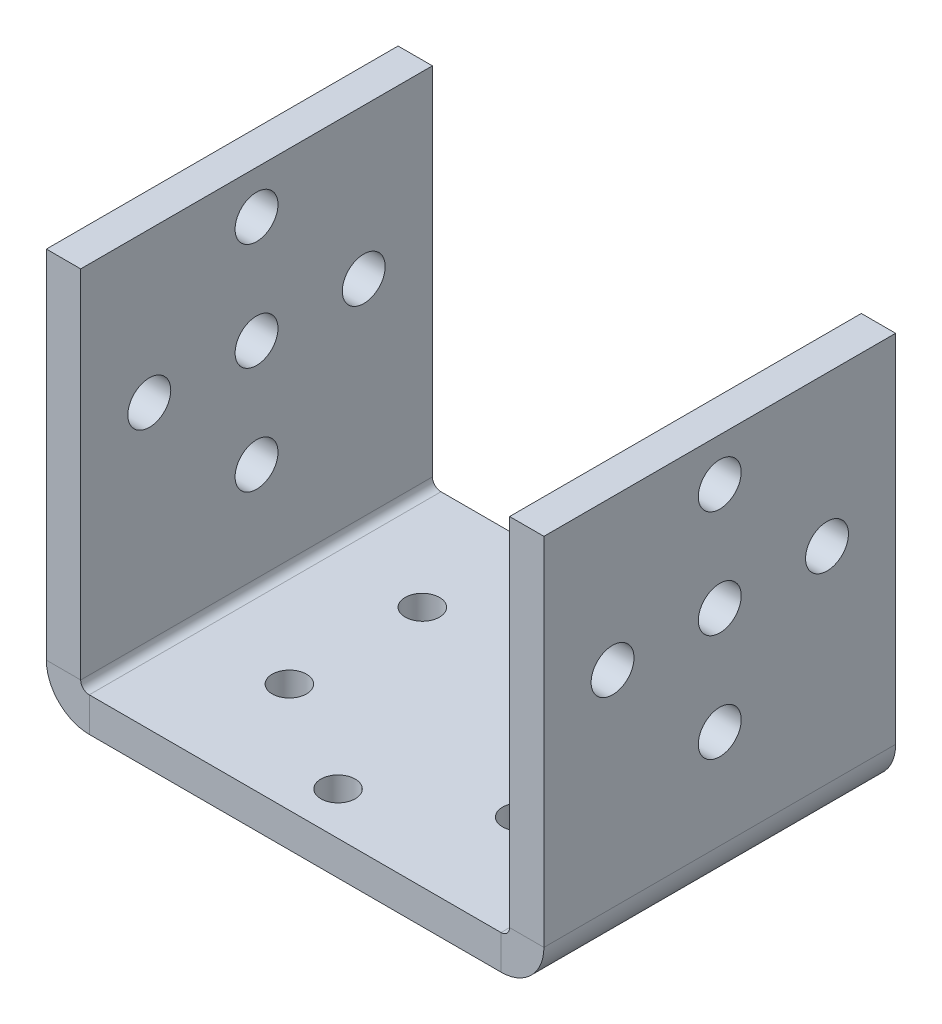
from build123d import *

# Parameters (mm, degrees)
SM_BASE_FLANGE_1_DEPTH   = 41
SKETCH_9_R               = 2
CUT_EXTRUDE_4_DEPTH      = 69.441580929
CUT_EXTRUDE_5_DEPTH      = 83.772277968
CUT_EXTRUDE_5_DEPTH_BACK = 83.772277968
SKETCH_10_R              = 2.5


# Sheet-metal steps are written as plain solids
with BuildPart() as part:
    # Sketch 1 → Базовая кромка1 (new body)
    with BuildSketch(Plane.XY):
        with BuildLine():
            Line((-25, 42.5), (-25, 1))
            ThreePointArc((-25, 1), (-24.707106781, 0.292893219), (-24, 0))
            Line((-24, 0), (24, 0))
            ThreePointArc((24, 0), (24.707106781, 0.292893219), (25, 1))
            Line((25, 1), (25, 42.5))
            Line((25, 42.5), (29, 42.5))
            Line((29, 42.5), (29, 1))
            ThreePointArc((29, 1), (27.535533906, -2.535533906), (24, -4))
            Line((24, -4), (-24, -4))
            ThreePointArc((-24, -4), (-27.535533906, -2.535533906), (-29, 1))
            Line((-29, 1), (-29, 42.5))
            Line((-29, 42.5), (-25, 42.5))
        make_face()
    extrude(amount=SM_BASE_FLANGE_1_DEPTH)

    # Эскиз9 → Вырез-Вытянуть4 (cut, through all)
    with BuildSketch(Plane.XZ.offset(4)):
        with Locations((0, 5)):
            Circle(SKETCH_9_R)
        with Locations((-13.423393759, 12.75)):
            Circle(SKETCH_9_R)
        with Locations((-13.423393759, 28.25)):
            Circle(SKETCH_9_R)
        with Locations((0, 36)):
            Circle(SKETCH_9_R)
        with Locations((13.423393759, 28.25)):
            Circle(SKETCH_9_R)
        with Locations((13.423393759, 12.75)):
            Circle(SKETCH_9_R)
    extrude(amount=-CUT_EXTRUDE_4_DEPTH, mode=Mode.SUBTRACT)

    # Эскиз10 → Вырез-Вытянуть5 (cut, two sides: drawn at the far end of the back side and taken through both)
    with BuildSketch(Plane(origin=(29, 0, 0), x_dir=(0, 0, -1), z_dir=(1, 0, 0)).offset(-CUT_EXTRUDE_5_DEPTH_BACK)):
        with Locations((-33, 25)):
            Circle(SKETCH_10_R)
        with Locations((-20.5, 25)):
            Circle(SKETCH_10_R)
        with Locations((-8, 25)):
            Circle(SKETCH_10_R)
        with Locations((-20.5, 12.5)):
            Circle(SKETCH_10_R)
        with Locations((-20.5, 37.5)):
            Circle(SKETCH_10_R)
    extrude(amount=CUT_EXTRUDE_5_DEPTH + CUT_EXTRUDE_5_DEPTH_BACK, mode=Mode.SUBTRACT)


solid = part.part
